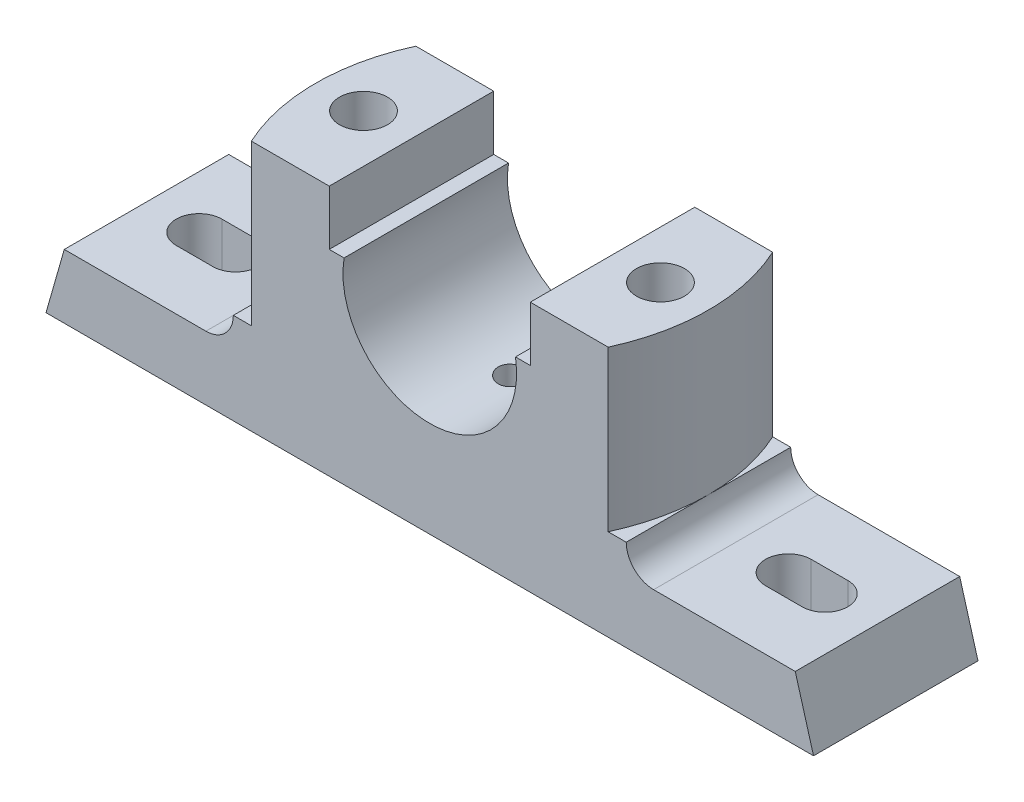
from build123d import *

# Parameters (mm, degrees)
SKETCH1_W                = 168
SKETCH1_H                = 55
BOSS_EXTRUDE2_DEPTH      = 36
CUT_EXTRUDE2_DEPTH       = 41
CUT_EXTRUDE4_DEPTH       = 35
SKETCH5_W                = 44
SKETCH5_H                = 36
CUT_EXTRUDE5_DEPTH       = 12
CUT_EXTRUDE6_DEPTH       = 42
SKETCH11_R               = 5.25
CUT_EXTRUDE8_DEPTH       = 53
CUT_EXTRUDE9_DEPTH       = 46
FILLET1_R                = 6
SKETCH30_W               = 68
SKETCH30_H               = 20
CUT_EXTRUDE14_DEPTH      = 2
CUT_EXTRUDE16_DEPTH      = 6
CUT_EXTRUDE16_DEPTH_BACK = 6
SKETCH31_R               = 3
SKETCH32_W               = 20
SKETCH32_H               = 20
CUT_EXTRUDE19_DEPTH      = 7
CUT_EXTRUDE21_DEPTH      = 12


with BuildPart() as part:
    # Sketch1 → Boss-Extrude2 (new body)
    with BuildSketch(Plane.XY):
        with Locations((38.207905975, 35.811584747)):
            Rectangle(SKETCH1_W, SKETCH1_H)
    extrude(amount=-BOSS_EXTRUDE2_DEPTH)

    # Sketch3 → Cut-Extrude2 (cut)
    with BuildSketch(Plane(origin=(0, 63.311584747, 0), x_dir=(1, 0, 0), z_dir=(0, 1, 0))):
        Polygon((122.207905975, 36), (81.207905975, 36), (81.207905975, 18.000000234), (81.207905975, 0), (122.207905975, 0), align=None)
        Polygon((-4.792094025, 18), (-4.792094025, 36), (-45.792094025, 36), (-45.792094025, 0), (-4.792094025, 0), align=None)
    extrude(amount=-CUT_EXTRUDE2_DEPTH, mode=Mode.SUBTRACT)

    # Sketch4 → Cut-Extrude4 (cut)
    with BuildSketch(Plane(origin=(0, 63.311584747, 0), x_dir=(1, 0, 0), z_dir=(0, 1, 0))):
        with BuildLine():
            Line((-0.843342405, 36), (-4.792094025, 36))
            Line((-4.792094025, 36), (-4.792094025, 18))
            ThreePointArc((-4.792094025, 18), (-3.793306391, 27.214019744), (-0.843342405, 36))
        make_face()
        with BuildLine():
            ThreePointArc((-0.843342405, 0), (-3.793306391, 8.785980256), (-4.792094025, 18))
            Line((-4.792094025, 18), (-4.792094025, 0))
            Line((-4.792094025, 0), (-0.843342405, 0))
        make_face()
        with BuildLine():
            Line((81.207905975, 36), (77.259154354, 36))
            ThreePointArc((77.259154354, 36), (80.20911834, 27.214019744), (81.207905975, 18))
            Line((81.207905975, 18), (81.207905975, 36))
        make_face()
        with BuildLine():
            ThreePointArc((81.207905975, 18), (80.20911834, 8.785980256), (77.259154354, 0))
            Line((77.259154354, 0), (81.207905975, 0))
            Line((81.207905975, 0), (81.207905975, 18))
        make_face()
    extrude(amount=-CUT_EXTRUDE4_DEPTH, mode=Mode.SUBTRACT)

    # Sketch5 → Cut-Extrude5 (cut)
    with BuildSketch(Plane(origin=(0, 63.311584747, 0), x_dir=(1, 0, 0), z_dir=(0, 1, 0))):
        with Locations((38.207905975, 18)):
            Rectangle(SKETCH5_W, SKETCH5_H)
    extrude(amount=-CUT_EXTRUDE5_DEPTH, mode=Mode.SUBTRACT)

    # Sketch8 → Cut-Extrude6 (cut)
    with BuildSketch(Plane.XY):
        with BuildLine():
            ThreePointArc((19.446242935, 51.311584747), (36.703179712, 29.37126271), (57.207905975, 48.311584747))
            ThreePointArc((57.207905975, 48.311584747), (57.148228012, 49.81631101), (56.969569014, 51.311584747))
            Line((56.969569014, 51.311584747), (19.446242935, 51.311584747))
        make_face()
        with BuildLine():
            Line((19.446242935, 51.311584747), (56.969569014, 51.311584747))
            ThreePointArc((56.969569014, 51.311584747), (38.207905975, 67.311584747), (19.446242935, 51.311584747))
        make_face()
    extrude(amount=-CUT_EXTRUDE6_DEPTH, mode=Mode.SUBTRACT)

    # Sketch11 → Cut-Extrude8 (cut)
    with BuildSketch(Plane(origin=(0, 63.311584747, 0), x_dir=(1, 0, 0), z_dir=(0, 1, 0))):
        with Locations(Location((5.707905975, 18, 0), (0, 0, 270))):
            Circle(SKETCH11_R)
        with Locations(Location((70.707905975, 18, 0), (0, 0, 90))):
            Circle(SKETCH11_R)
    extrude(amount=-CUT_EXTRUDE8_DEPTH, mode=Mode.SUBTRACT)

    # Sketch13 → Cut-Extrude9 (cut)
    with BuildSketch(Plane.XY):
        Polygon((-45.792094025, 22.311584747), (-45.792094025, 8.311584747), (-41.792094025, 22.311584747), align=None)
        Polygon((122.207905975, 22.311584747), (118.207905975, 22.311584747), (122.207905975, 8.311584747), align=None)
    extrude(amount=-CUT_EXTRUDE9_DEPTH, mode=Mode.SUBTRACT)

    # Fillet1
    fillet1_edges = [part.edges().sort_by_distance(p)[0] for p in [
        (81.207905975, 22.311584747, -18),
        (-4.792094025, 22.311584747, -18),
    ]]
    fillet(fillet1_edges, radius=FILLET1_R - 0.0001)  # a hair under: the kernel refuses the full size

    # Sketch30 → Cut-Extrude14 (cut)
    with BuildSketch(Plane.XZ.offset(-8.311584747)):
        with Locations((-3.792094025, -18)):
            Rectangle(SKETCH30_W, SKETCH30_H)
        with Locations((80.207905975, -18)):
            Rectangle(SKETCH30_W, SKETCH30_H)
    extrude(amount=-CUT_EXTRUDE14_DEPTH, mode=Mode.SUBTRACT)

    # Sketch31 → Cut-Extrude16 (cut, two sides: drawn at the far end of the back side and taken through both)
    with BuildSketch(Plane(origin=(0, 29, 0), x_dir=(1, 0, 0), z_dir=(0, 1, 0)).offset(-CUT_EXTRUDE16_DEPTH_BACK)):
        with Locations(Location((38.207905975, 18, 0), (0, 0, 90))):
            Circle(SKETCH31_R)
    extrude(amount=CUT_EXTRUDE16_DEPTH + CUT_EXTRUDE16_DEPTH_BACK, mode=Mode.SUBTRACT)

    # Sketch32 → Cut-Extrude19 (cut)
    with BuildSketch(Plane.XZ.offset(-10.311584747)):
        with Locations((6.207905975, -18)):
            Rectangle(SKETCH32_W, SKETCH32_H)
        with Locations((71.078776846, -18)):
            Rectangle(SKETCH32_W, SKETCH32_H)
    extrude(amount=-CUT_EXTRUDE19_DEPTH, mode=Mode.SUBTRACT)

    # Sketch15 → Cut-Extrude21 (cut)
    with BuildSketch(Plane(origin=(0, 22.311584747, 0), x_dir=(1, 0, 0), z_dir=(0, 1, 0))):
        with BuildLine():
            Line((-30.292094025, 23), (-22.292094025, 23))
            ThreePointArc((-22.292094025, 23), (-17.292094025, 18), (-22.292094025, 13))
            Line((-22.292094025, 13), (-30.292094025, 13))
            ThreePointArc((-30.292094025, 13), (-35.292094025, 18), (-30.292094025, 23))
        make_face()
        with BuildLine():
            Line((98.707905975, 23), (106.707905975, 23))
            ThreePointArc((106.707905975, 23), (111.707905975, 18), (106.707905975, 13))
            Line((106.707905975, 13), (98.707905975, 13))
            ThreePointArc((98.707905975, 13), (93.707905975, 18), (98.707905975, 23))
        make_face()
    extrude(amount=-CUT_EXTRUDE21_DEPTH, mode=Mode.SUBTRACT)


solid = part.part
